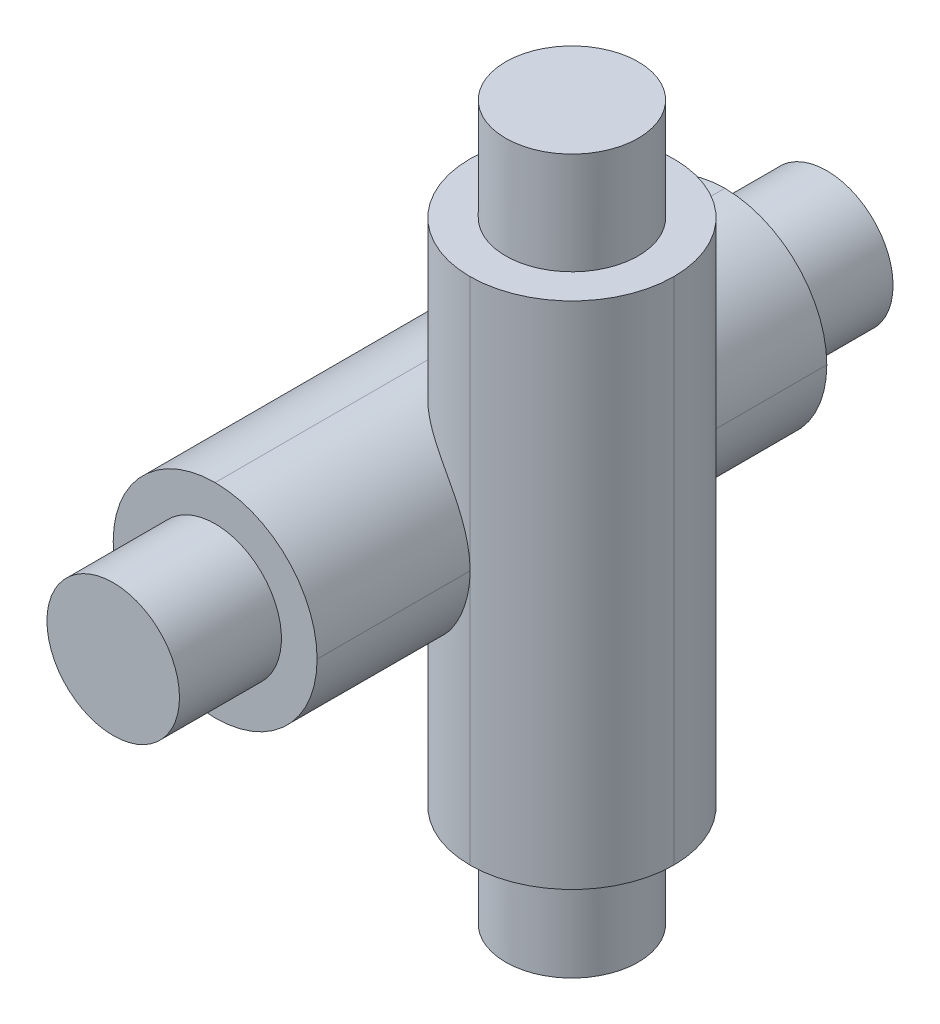
from build123d import *

# Parameters (mm, degrees)
SKETCH2_W           = 20
SKETCH2_H           = 20
BOSS_EXTRUDE1_DEPTH = 25
SKETCH4_W           = 20
SKETCH4_H           = 20
BOSS_EXTRUDE2_DEPTH = 25
SKETCH5_R           = 6.5
BOSS_EXTRUDE3_DEPTH = 35
SKETCH7_R           = 6.5
BOSS_EXTRUDE4_DEPTH = 35
FILLET1_START       = -25
FILLET1_DEPTH       = 50
FILLET1_START_2     = 10
FILLET1_2_DEPTH     = 15
FILLET1_3_DEPTH     = 50
FILLET2_R           = 10
FILLET3_START       = -1e-07
FILLET3_DEPTH       = 25.0000001
FILLET3_START_2     = -25
FILLET3_2_DEPTH     = 34.870059035
FILLET3_START_3     = -10
FILLET3_3_DEPTH     = 20
FILLET4_R           = 10
FILLET5_START       = -25
FILLET5_DEPTH       = 50
FILLET5_2_DEPTH     = 24.9999999
FILLET5_START_2     = -10
FILLET5_3_DEPTH     = 20


with BuildPart() as part:
    # Sketch2 → Boss-Extrude1 (new, symmetric)
    with BuildSketch(Plane.XY):
        Rectangle(SKETCH2_W, SKETCH2_H)
    extrude(amount=BOSS_EXTRUDE1_DEPTH, both=True)

    # Sketch4 → Boss-Extrude2 (add, symmetric)
    with BuildSketch(Plane(origin=(0, 0, 0), x_dir=(1, 0, 0), z_dir=(0, 1, 0))):
        with Locations((10, 0)):
            Rectangle(SKETCH4_W, SKETCH4_H)
    extrude(amount=BOSS_EXTRUDE2_DEPTH, both=True)

    # Sketch5 → Boss-Extrude3 (add, symmetric)
    with BuildSketch(Plane(origin=(0, 0, 0), x_dir=(1, 0, 0), z_dir=(0, 1, 0))):
        with Locations(Location((10, 0, 0), (0, 0, 90))):
            Circle(SKETCH5_R)
    extrude(amount=BOSS_EXTRUDE3_DEPTH, both=True)

    # Sketch7 → Boss-Extrude4 (add, symmetric)
    with BuildSketch(Plane.XY):
        with Locations(Location((0, 0, 0), (0, 0, 180))):
            Circle(SKETCH7_R)
    extrude(amount=BOSS_EXTRUDE4_DEPTH, both=True)

    # Fillet1: read off the stored shape, not the designer's step
    # Fillet1 outline → Fillet1 (cut)
    with BuildSketch(Plane(origin=(0, 0, 0), x_dir=(1, 0, 0), z_dir=(0, 1, 0)).offset(FILLET1_START)):
        with BuildLine():
            Line((20, 10), (10, 10))
            ThreePointArc((10, 10), (17.071067812, 7.071067812), (20, 0))
            Line((20, 0), (20, 10))
        make_face()
    extrude(amount=FILLET1_DEPTH, mode=Mode.SUBTRACT)

    # Fillet1 2 outline → Fillet1 2 (cut)
    with BuildSketch(Plane(origin=(0, 0, 0), x_dir=(1, 0, 0), z_dir=(0, 1, 0)).offset(FILLET1_START_2)):
        with BuildLine():
            ThreePointArc((10, -10), (2.928932188, -7.071067812), (0, 0))
            Line((0, 0), (0, -10))
            Line((0, -10), (10, -10))
        make_face()
    extrude(amount=FILLET1_2_DEPTH, mode=Mode.SUBTRACT)

    # Fillet1 3 outline → Fillet1 3 (cut)
    with BuildSketch(Plane.XY.offset(FILLET1_START)):
        with BuildLine():
            Line((-10, 10), (-10, 0))
            ThreePointArc((-10, 0), (-7.071067812, 7.071067812), (0, 10))
            Line((0, 10), (-10, 10))
        make_face()
    extrude(amount=FILLET1_3_DEPTH, mode=Mode.SUBTRACT)

    # Fillet2
    fillet2_edges = [part.edges().sort_by_distance(p)[0] for p in [
        (20, 0, 10),
        (10, 10, -17.5),
        (10, -10, 17.5),
    ]]
    fillet(fillet2_edges, radius=FILLET2_R - 0.0001)  # a hair under: the kernel refuses the full size

    # Fillet3: read off the stored shape, not the designer's step
    # Fillet3 outline → Fillet3 (cut)
    with BuildSketch(Plane.XY.offset(FILLET3_START)):
        with BuildLine():
            Line((10, 10), (0, 10))
            ThreePointArc((0, 10), (7.071067812, 7.071067812), (10, 0))
            Line((10, 0), (10, 10))
        make_face()
        with BuildLine():
            Line((-10, -10), (0, -10))
            ThreePointArc((0, -10), (-7.071067812, -7.071067812), (-10, 0))
            Line((-10, 0), (-10, -10))
        make_face()
    extrude(amount=FILLET3_DEPTH, mode=Mode.SUBTRACT)

    # Fillet3 2 outline → Fillet3 2 (cut)
    with BuildSketch(Plane.XY.offset(FILLET3_START_2)):
        with BuildLine():
            Line((-10, -10), (0, -10))
            ThreePointArc((0, -10), (-7.071067812, -7.071067812), (-10, 0))
            Line((-10, 0), (-10, -10))
        make_face()
    extrude(amount=FILLET3_2_DEPTH, mode=Mode.SUBTRACT)

    # Fillet3 3 outline → Fillet3 3 (add)
    with BuildSketch(Plane(origin=(0, 0, 0), x_dir=(1, 0, 0), z_dir=(0, 1, 0)).offset(FILLET3_START_3)):
        with BuildLine():
            ThreePointArc((0, 0), (2.928932188, -7.071067812), (10, -10))
            Line((10, -10), (10, 1e-07))
            Line((10, 1e-07), (0, 0))
        make_face()
    extrude(amount=FILLET3_3_DEPTH)

    # Fillet4
    fillet4_edges = [part.edges().sort_by_distance(p)[0] for p in [
        (10, -10, -17.5),
    ]]
    fillet(fillet4_edges, radius=FILLET4_R - 0.0001)  # a hair under: the kernel refuses the full size

    # Fillet5: read off the stored shape, not the designer's step
    # Fillet5 outline → Fillet5 (cut)
    with BuildSketch(Plane(origin=(0, 0, 0), x_dir=(1, 0, 0), z_dir=(0, 1, 0)).offset(FILLET5_START)):
        with BuildLine():
            Line((0, 10), (0, 0))
            ThreePointArc((0, 0), (2.928932188, 7.071067812), (10, 10))
            Line((10, 10), (0, 10))
        make_face()
    extrude(amount=FILLET5_DEPTH, mode=Mode.SUBTRACT)

    # Fillet5 2 outline → Fillet5 2 (cut)
    with BuildSketch(Plane(origin=(0, 0, 0), x_dir=(1, 0, 0), z_dir=(0, 1, 0)).offset(FILLET5_START)):
        with BuildLine():
            ThreePointArc((10, -10), (2.928932188, -7.071067812), (0, 0))
            Line((0, 0), (0, -10))
            Line((0, -10), (10, -10))
        make_face()
    extrude(amount=FILLET5_2_DEPTH, mode=Mode.SUBTRACT)

    # Fillet5 3 outline → Fillet5 3 (add)
    with BuildSketch(Plane.XY.offset(FILLET5_START_2)):
        with BuildLine():
            ThreePointArc((10, 0), (7.071067812, 7.071067812), (0, 10))
            Line((0, 10), (0, -10))
            ThreePointArc((0, -10), (7.071067812, -7.071067812), (10, 0))
        make_face()
    extrude(amount=FILLET5_3_DEPTH)


solid = part.part
